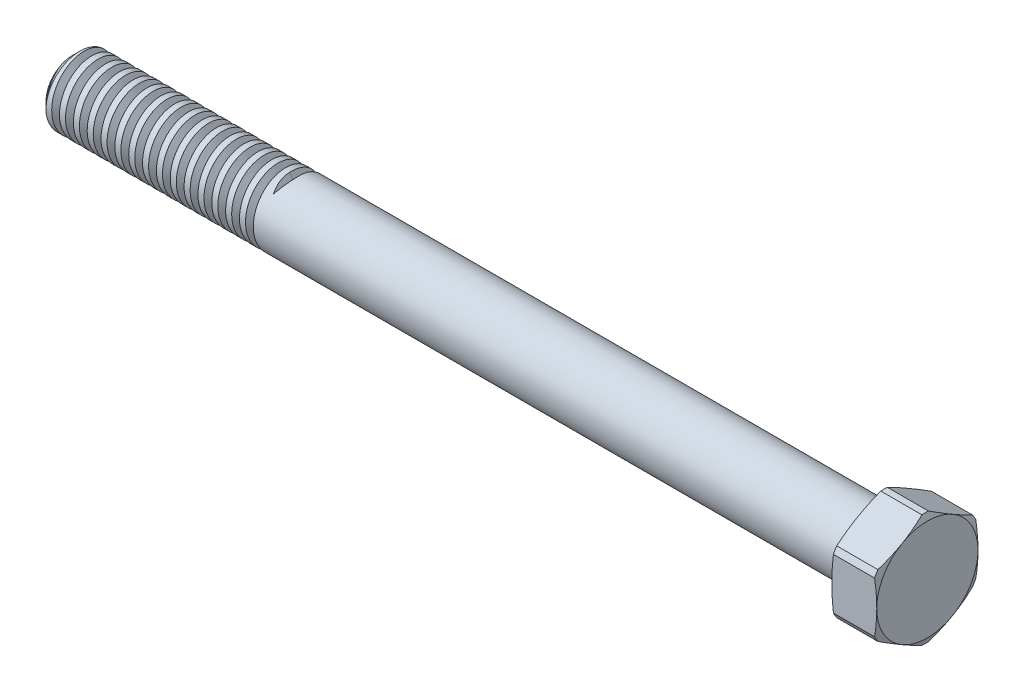
from build123d import *

# Parameters (mm, degrees)
SKETCH2_OUTSIDE_W  = 42.54
SKETCH2_OUTSIDE_H  = 42.54
CUT_EXTRUDE1_DEPTH = 122.178624746
CUT_SWEEP1_PITCH   = 1.953846154
CUT_EXTRUDE2_DEPTH = 62.270360687


with BuildPart() as part:
    # Sketch1 → Revolve1 (revolve)
    with BuildSketch(Plane.XY, mode=Mode.PRIVATE) as revolve1_sk:
        Polygon((-60.325, 0), (-60.325, 3.7465), (-59.309, 4.7625), (53.975, 4.7625), (53.975, 7.119988845), (54.209429586, 7.994891971), (60.015209657, 7.994891971), (60.325, 7.14375), (60.325, 0), align=None)
    revolve(revolve1_sk.sketch.rotate(Axis((-60.325, 0, 0), (1, 0, 0)), 180), axis=Axis((-60.325, 0, 0), (1, 0, 0)))

    # Sketch2 outside → Cut-Extrude1 (cut, through all)
    with BuildSketch(Plane(origin=(60.325, 0, 0), x_dir=(0, 0, -1), z_dir=(1, 0, 0))):
        Rectangle(SKETCH2_OUTSIDE_W, SKETCH2_OUTSIDE_H)
        Polygon((0, 8.248891971), (-7.14375, 4.124445986), (-7.14375, -4.124445986), (0, -8.248891971), (7.14375, -4.124445986), (7.14375, 4.124445986), align=None, mode=Mode.SUBTRACT)
    extrude(amount=-CUT_EXTRUDE1_DEPTH, mode=Mode.SUBTRACT)

    # Cut-Sweep1: the profile of Sketch4 profile screwed along a right-hand helix of 16.25 turns, 10 arcs to a turn; built about Z, then put on its axis
    cut_sweep1_z = Axis((0, 0, 0), (0, 0, 1))
    cut_sweep1_corners = [(4.7628, 0, 0.000173205), (4.7628, 0, -1.100025468), (3.81, 0, -0.549926131)]
    with BuildLine(mode=Mode.PRIVATE) as cut_sweep1_profile:
        Line(cut_sweep1_corners[0], cut_sweep1_corners[1])
        Line(cut_sweep1_corners[1], cut_sweep1_corners[2])
        Line(cut_sweep1_corners[2], cut_sweep1_corners[0])
    cut_sweep1_cap = Face(cut_sweep1_profile.wire())
    cut_sweep1_turn_angles = [0, 18, 36, 54, 72, 90, 108, 126, 144, 162, 180, 198, 216, 234, 252, 270, 288, 306, 324, 342, 360]
    cut_sweep1_turn_weights = [1, 0.9510565162951535, 1, 0.9510565162951535, 1, 0.9510565162951535, 1, 0.9510565162951535, 1, 0.9510565162951535, 1, 0.9510565162951535, 1, 0.9510565162951535, 1, 0.9510565162951535, 1, 0.9510565162951535, 1, 0.9510565162951535, 1]
    cut_sweep1_turn_rails = [Edge.make_bspline([Vector(p[0], p[1], 0).rotate(cut_sweep1_z, cut_sweep1_turn_angles[k]) / cut_sweep1_turn_weights[k] + Vector(0, 0, p[2] + CUT_SWEEP1_PITCH * cut_sweep1_turn_angles[k] / 360) for k in range(21)], [0, 0, 0, 1, 1, 2, 2, 3, 3, 4, 4, 5, 5, 6, 6, 7, 7, 8, 8, 9, 9, 10, 10, 10], 2, cut_sweep1_turn_weights) for p in cut_sweep1_corners]
    cut_sweep1_turn_sides = [Face.make_surface_from_curves(cut_sweep1_turn_rails[p[0]], cut_sweep1_turn_rails[p[1]]) for p in [(0, 1), (1, 2), (2, 0)]]
    cut_sweep1_last_angles = [5760, 5778, 5796, 5814, 5832, 5841, 5850]
    cut_sweep1_last_weights = [1, 0.9510565162951535, 1, 0.9510565162951535, 1, 0.9876883405950794, 1]
    cut_sweep1_last_rails = [Edge.make_bspline([Vector(p[0], p[1], 0).rotate(cut_sweep1_z, cut_sweep1_last_angles[k]) / cut_sweep1_last_weights[k] + Vector(0, 0, p[2] + CUT_SWEEP1_PITCH * cut_sweep1_last_angles[k] / 360) for k in range(7)], [0, 0, 0, 1, 1, 2, 2, 3, 3, 3], 2, cut_sweep1_last_weights) for p in cut_sweep1_corners]
    cut_sweep1_last_sides = [Face.make_surface_from_curves(cut_sweep1_last_rails[p[0]], cut_sweep1_last_rails[p[1]]) for p in [(0, 1), (1, 2), (2, 0)]]
    cut_sweep1 = Plane(origin=(-60.325, 0, 0), x_dir=(0, 0, -1), z_dir=(1, 0, 0)) * Solid(Shell([*[p.moved(Location((0, 0, CUT_SWEEP1_PITCH * i))) for i in range(16) for p in cut_sweep1_turn_sides], *cut_sweep1_last_sides, cut_sweep1_cap, cut_sweep1_cap.rotate(cut_sweep1_z, 5850).moved(Location((0, 0, CUT_SWEEP1_PITCH * 5850 / 360)))]))
    add(cut_sweep1, mode=Mode.SUBTRACT)

    # Sketch5 → Cut-Extrude2 (cut, through all)
    with BuildSketch(Plane(origin=(0, 0, 0), x_dir=(-1, 0, 0), z_dir=(0, 0, -1))):
        Polygon((29.674852263, 4.7625), (28.575, 4.7625), (29.124926131, 3.81), align=None)
    extrude(amount=-CUT_EXTRUDE2_DEPTH, mode=Mode.SUBTRACT)


solid = part.part
